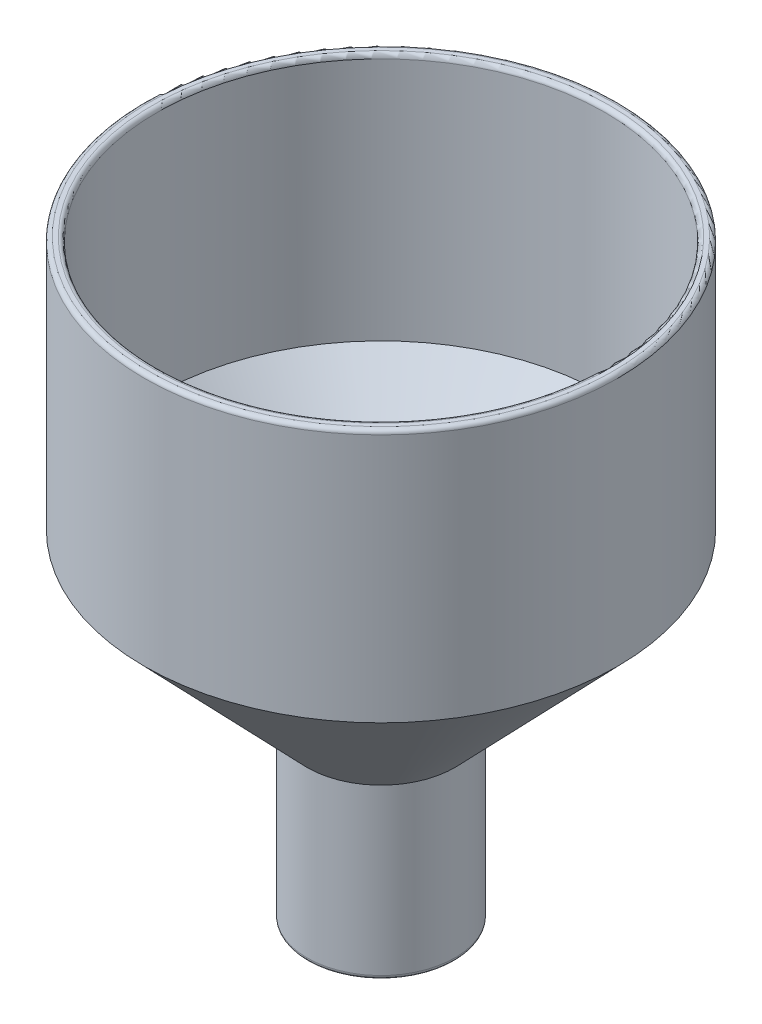
from build123d import *

# Parameters (mm, degrees)
FILLET1_R = 0.5


with BuildPart() as part:
    # Sketch1 → Revolve1 (revolve)
    with BuildSketch(Plane.XY):
        Polygon((-7.25, 0.08330694), (-7.25, 20.68790493), (-26.5, 40.68790493), (-26.5, 70.08330694), (-28, 70.08330694), (-28, 40.08330694), (-8.75, 20.08330694), (-8.75, 0.08330694), align=None)
    revolve(axis=Axis((0, 0, 0), (0, 1, 0)))

    # Fillet1
    fillet1_edges = [part.edges().sort_by_distance(p)[0] for p in [
        (26.5, 70.08330694, 0),
        (28, 70.08330694, 0),
        (7.25, 0.08330694, 0),
        (8.75, 0.08330694, 0),
    ]]
    fillet(fillet1_edges, radius=FILLET1_R)


solid = part.part
